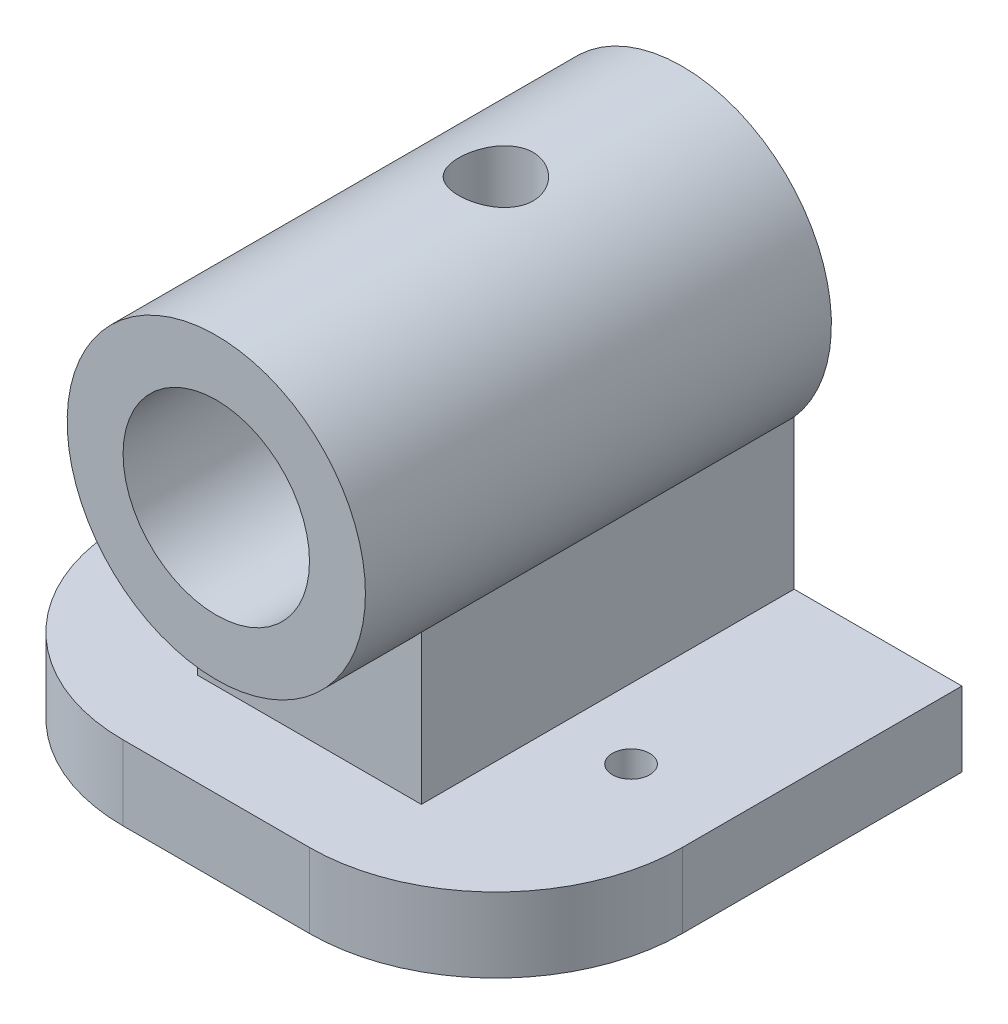
from build123d import *

# Parameters (mm, degrees)
SKETCH1_R             = 8
SKETCH1_R_2           = 5
BOSS_EXTRUDE1_DEPTH   = 12.5
SKETCH1_W             = 30
SKETCH1_H             = 4
BOSS_EXTRUDE1_2_DEPTH = 12.5
BOSS_EXTRUDE2_START   = 7.5
BOSS_EXTRUDE2_DEPTH   = 20
SKETCH2_R             = 1
CUT_EXTRUDE1_DEPTH    = 4
CUT_EXTRUDE2_START    = -26
CUT_EXTRUDE2_DEPTH    = 5


with BuildPart() as part:
    # Sketch1 → Boss-Extrude1 (new, symmetric)
    with BuildSketch(Plane.XY):
        with Locations((-0.566068823, 50.177224178)):
            Circle(SKETCH1_R)
        with Locations((-0.566068823, 50.177224178)):
            Circle(SKETCH1_R_2, mode=Mode.SUBTRACT)
    extrude(amount=BOSS_EXTRUDE1_DEPTH, both=True)



with BuildPart() as body_2:
    # Sketch1 → Boss-Extrude1 2 (new, symmetric)
    with BuildSketch(Plane.XY):
        with Locations((-0.566068823, 34.885721556)):
            Rectangle(SKETCH1_W, SKETCH1_H)
    extrude(amount=BOSS_EXTRUDE1_2_DEPTH, both=True)


with BuildPart() as part_1:
    add(part.part)

    add(body_2.part)  # Boss-Extrude2 merges body 2
    # Sketch1<5> → Boss-Extrude2 (add)
    with BuildSketch(Plane.XY.offset(BOSS_EXTRUDE2_START)):
        with BuildLine():
            Line((-6.566068823, 44.885721556), (-6.566068823, 36.885721556))
            Line((-6.566068823, 36.885721556), (5.433931177, 36.885721556))
            Line((5.433931177, 36.885721556), (5.433931177, 44.885721556))
            ThreePointArc((5.433931177, 44.885721556), (-0.566068823, 42.177224178), (-6.566068823, 44.885721556))
        make_face()
    extrude(amount=-BOSS_EXTRUDE2_DEPTH)

    # Sketch2 → Cut-Extrude1 (cut)
    with BuildSketch(Plane.XZ.offset(-32.885721556)):
        with BuildLine():
            ThreePointArc((-15.566068823, 2.5), (-12.637136635, 9.571067812), (-5.566068823, 12.5))
            Line((-5.566068823, 12.5), (-15.566068823, 12.5))
            Line((-15.566068823, 12.5), (-15.566068823, 2.5))
        make_face()
        with Locations(Location((-10.316068823, 0, 0), (0, 0, 270))):
            Circle(SKETCH2_R)
        with BuildLine():
            Line((14.433931177, 12.5), (4.433931177, 12.5))
            ThreePointArc((4.433931177, 12.5), (11.504998989, 9.571067812), (14.433931177, 2.5))
            Line((14.433931177, 2.5), (14.433931177, 12.5))
        make_face()
        with Locations(Location((9.183931177, 0, 0), (0, 0, 270))):
            Circle(SKETCH2_R)
    extrude(amount=-CUT_EXTRUDE1_DEPTH, mode=Mode.SUBTRACT)

    # Cut-Extrude2: read off the stored shape, not the designer's step
    # Cut-Extrude2 outline → Cut-Extrude2 (cut)
    with BuildSketch(Plane.XZ.offset(-32.885721556).offset(CUT_EXTRUDE2_START)):
        with BuildLine():
            add(Edge.make_bspline(
                [(-0.566068823, -4.5), (-0.035293393, -4.5), (0.481128127, -4.281375894), (1.215722466, -3.546490005), (1.433600027, -3.025317772), (1.434261529, -1.977206776), (1.218792073, -1.456508795), (0.477783673, -0.715350376), (-0.041929223, -0.500221589), (-1.08851599, -0.499778769), (-1.610163203, -0.716198326), (-2.348367378, -1.45334182), (-2.565791182, -1.971191938), (-2.566345912, -3.026705842), (-2.348095204, -3.545904648), (-1.614377567, -4.28061319), (-1.096844254, -4.5), (-0.566068823, -4.5)],
                knots=[0, 0, 0, 0, 0.125, 0.125, 0.25, 0.25, 0.375, 0.375, 0.5, 0.5, 0.625, 0.625, 0.75, 0.75, 0.875, 0.875, 1, 1, 1, 1], degree=3))
        make_face()
    extrude(amount=CUT_EXTRUDE2_DEPTH, mode=Mode.SUBTRACT)


solid = part_1.part
